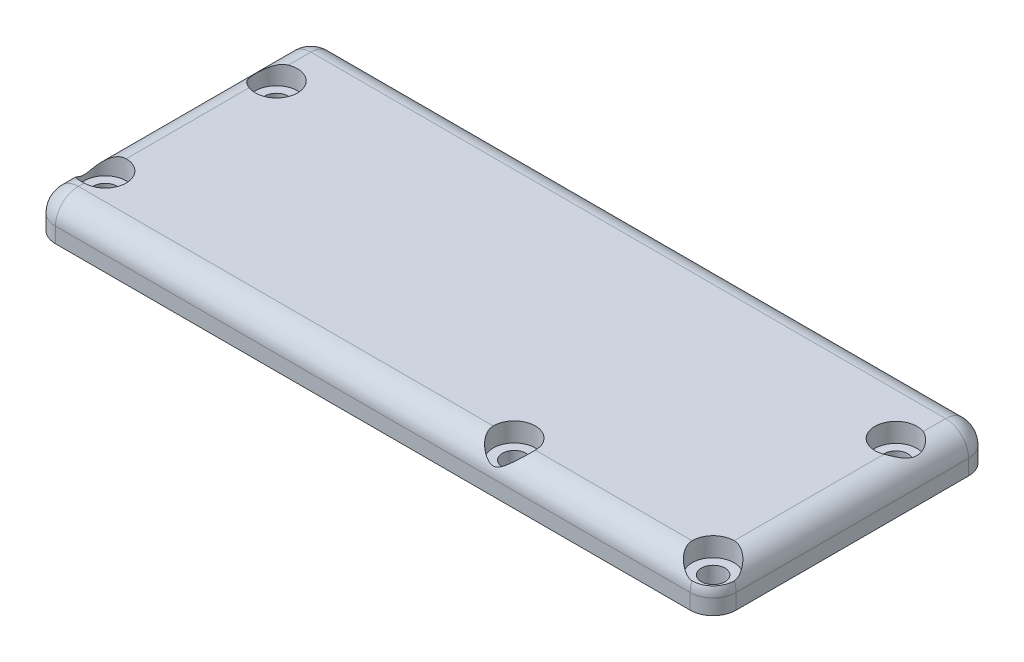
from build123d import *

# Parameters (mm, degrees)
SKETCH1_W                        = 89
SKETCH1_H                        = 36.4
BOSS_EXTRUDE1_DEPTH              = 5
CBORE_FOR_M2_5_SHCS1_D           = 3.1
CBORE_FOR_M2_5_SHCS1_CBORE_D     = 5.5
CBORE_FOR_M2_5_SHCS1_CBORE_DEPTH = 2.5
FILLET3_R                        = 3
FILLET4_R                        = 3


with BuildPart() as part:
    # Sketch1 → Boss-Extrude1 (new body)
    with BuildSketch(Plane(origin=(0, 0, 0), x_dir=(1, 0, 0), z_dir=(0, 1, 0))):
        Rectangle(SKETCH1_W, SKETCH1_H)
    extrude(amount=BOSS_EXTRUDE1_DEPTH)

    # CBORE for M2.5 SHCS1 (through all)
    with Locations(Plane(origin=(0, 5, 0), x_dir=(1, 0, 0), z_dir=(0, 1, 0))):
        with Locations((-40.5, 9.7), (-41.5, -11.7), (15.5, -15.2), (41.5, -15.2), (40.5, 9.7)):
            CounterBoreHole(CBORE_FOR_M2_5_SHCS1_D / 2, CBORE_FOR_M2_5_SHCS1_CBORE_D / 2, CBORE_FOR_M2_5_SHCS1_CBORE_DEPTH)

    # Fillet3
    fillet3_edges = [part.edges().sort_by_distance(p)[0] for p in [
        (44.5, 2.5, 18.2),
        (-44.5, 2.5, 18.2),
        (-44.5, 2.5, -18.2),
        (44.5, 2.5, -18.2),
    ]]
    fillet(fillet3_edges, radius=FILLET3_R)

    # Fillet4
    # the kernel refuses this fillet: 3 mm, written as the material it takes off along each edge
    with BuildSketch(Plane(origin=(-41.5, 5, -15.2), x_dir=(-1, 0, 0), z_dir=(0, 0, 1))) as fillet4_piece_1:
        with BuildLine():
            CenterArc((3 - FILLET4_R, FILLET4_R), FILLET4_R, 270, 90)
            Line((3, FILLET4_R), (3, 0))
            Line((3, 0), (3 - FILLET4_R, 0))
        make_face()
    revolve(axis=Axis((-41.5, 5, -15.2), (0, -1, 0)), revolution_arc=90, mode=Mode.SUBTRACT)
    with BuildSketch(Plane(origin=(41.5, 5, -18.2), x_dir=(0, 0, 1), z_dir=(-1, 0, 0))) as fillet4_piece_2:
        with BuildLine():
            CenterArc((FILLET4_R, -FILLET4_R), FILLET4_R, 90, 90)
            Line((0, -FILLET4_R), (0, 0))
            Line((0, 0), (FILLET4_R, 0))
        make_face()
    extrude(amount=83, mode=Mode.SUBTRACT)
    with BuildSketch(Plane(origin=(41.5, 5, -15.2), x_dir=(1, 0, 0), z_dir=(0, 0, 1))) as fillet4_piece_3:
        with BuildLine():
            CenterArc((3 - FILLET4_R, -FILLET4_R), FILLET4_R, 0, 90)
            Line((3, -FILLET4_R), (3, 0))
            Line((3, 0), (3 - FILLET4_R, 0))
        make_face()
    revolve(axis=Axis((41.5, 5, -15.2), (0, 1, 0)), revolution_arc=90, mode=Mode.SUBTRACT)
    with BuildSketch(Plane(origin=(44.5, 5, 15.2), x_dir=(-1, 0, 0), z_dir=(0, 0, -1)), Plane(origin=(-44.5, 5, -15.2), x_dir=(1, 0, 0), z_dir=(0, 0, 1))) as fillet4_piece_4:
        with BuildLine():
            CenterArc((FILLET4_R, -FILLET4_R), FILLET4_R, 90, 90)
            Line((0, -FILLET4_R), (0, 0))
            Line((0, 0), (FILLET4_R, 0))
        make_face()
    extrude(amount=30.4, mode=Mode.SUBTRACT)
    with BuildSketch(Plane(origin=(-41.5, 5, 18.2), x_dir=(0, -1, 0), z_dir=(1, 0, 0))) as fillet4_piece_5:
        with BuildLine():
            CenterArc((FILLET4_R, FILLET4_R), FILLET4_R, 180, 90)
            Line((0, FILLET4_R), (0, 0))
            Line((0, 0), (FILLET4_R, 0))
        make_face()
    extrude(amount=83, mode=Mode.SUBTRACT)
    with BuildSketch(Plane(origin=(-41.5, 5, 15.2), x_dir=(0, 0, 1), z_dir=(1, 0, 0))) as fillet4_piece_6:
        with BuildLine():
            CenterArc((3 - FILLET4_R, FILLET4_R), FILLET4_R, 270, 90)
            Line((3 - FILLET4_R, 0), (3, 0))
            Line((3, 0), (3, FILLET4_R))
        make_face()
    revolve(axis=Axis((-41.5, 5, 15.2), (0, -1, 0)), revolution_arc=90, mode=Mode.SUBTRACT)
    with BuildSketch(Plane(origin=(41.5, 5, 15.2), x_dir=(0, 0, 1), z_dir=(-1, 0, 0))) as fillet4_piece_7:
        with BuildLine():
            CenterArc((3 - FILLET4_R, -FILLET4_R), FILLET4_R, 0, 90)
            Line((3 - FILLET4_R, 0), (3, 0))
            Line((3, 0), (3, -FILLET4_R))
        make_face()
    revolve(axis=Axis((41.5, 5, 15.2), (0, 1, 0)), revolution_arc=90, mode=Mode.SUBTRACT)


solid = part.part
